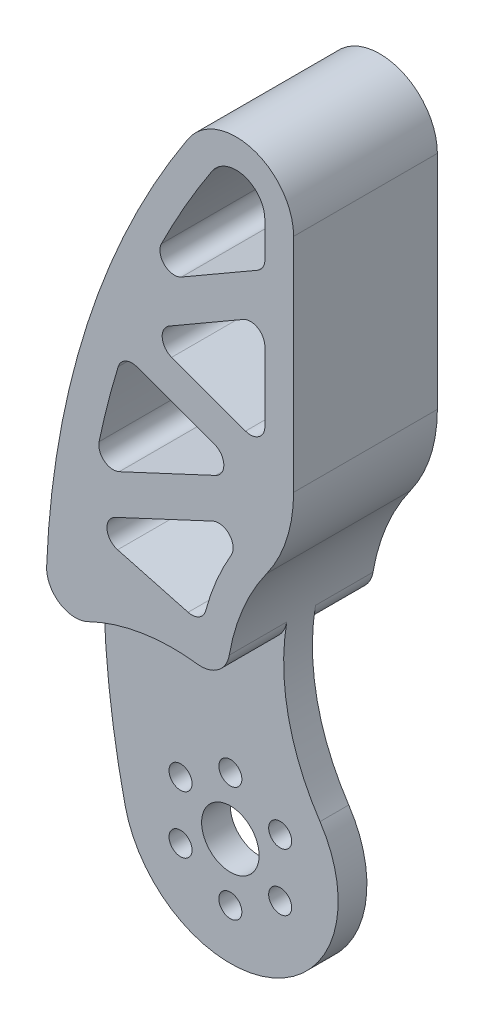
from build123d import *
from build123d.topology import SkipClean

# Parameters (mm, degrees)
SKETCH_1_R           = 15
SKETCH_1_R_2         = 4
SKETCH_1_R_3         = 1.6
EXTRUDE_1_DEPTH      = 4
EXTRUDE_START        = -4
EXTRUDE_3_DEPTH      = 4
EXTRUDE_4_DEPTH      = 8
EXTRUDE_4_DEPTH_BACK = 12
CUT_EXTRUDE_1_DEPTH  = 46


with BuildPart() as part:
    # 草图1 → 凸台-拉伸1 (new body)
    with BuildSketch(Plane.XY):
        Circle(SKETCH_1_R)
        Circle(SKETCH_1_R_2, mode=Mode.SUBTRACT)
        with Locations((0, 8)):
            Circle(SKETCH_1_R_3, mode=Mode.SUBTRACT)
        with Locations((6.92820323, 4)):
            Circle(SKETCH_1_R_3, mode=Mode.SUBTRACT)
        with Locations((6.92820323, -4)):
            Circle(SKETCH_1_R_3, mode=Mode.SUBTRACT)
        with Locations((0, -8)):
            Circle(SKETCH_1_R_3, mode=Mode.SUBTRACT)
        with Locations((-6.92820323, -4)):
            Circle(SKETCH_1_R_3, mode=Mode.SUBTRACT)
        with Locations((-6.92820323, 4)):
            Circle(SKETCH_1_R_3, mode=Mode.SUBTRACT)
    extrude(amount=EXTRUDE_1_DEPTH)

    # 草图2 → 凸台-拉伸3 (add)
    with BuildSketch(Plane.XY.offset(4).offset(EXTRUDE_START)):
        with BuildLine():
            Line((16.8, 85), (16.8, 54.159799849))
            ThreePointArc((16.8, 54.159799849), (15.83854762, 48.033324147), (13.046629547, 42.49587991))
            ThreePointArc((13.046629547, 42.49587991), (7.420814059, 25.504374344), (12.472191289, 8.333333333))
            ThreePointArc((12.472191289, 8.333333333), (-5.937882388, 13.774670695), (-14.621995932, -3.346226976))
            ThreePointArc((-14.621995932, -3.346226976), (-15.737901413, 44.738127218), (2.117573463, 89.398315084))
            ThreePointArc((2.117573463, 89.398315084), (11.095712057, 92.663530919), (16.8, 85))
        make_face()
    extrude(amount=EXTRUDE_3_DEPTH)

    # 草图3 → 凸台-拉伸4 (add, two sides: drawn at the far end of the back side and taken through both)
    with SkipClean():  # the faces are left unmerged after this step: merging them gives an invalid solid
        with BuildSketch(Plane.XY.offset(4).offset(-EXTRUDE_4_DEPTH_BACK)):
            with BuildLine():
                Line((16.8, 54.159799849), (16.8, 85))
                ThreePointArc((16.8, 85), (11.095712057, 92.663530919), (2.117573463, 89.398315084))
                ThreePointArc((2.117573463, 89.398315084), (-11.916705707, 60.059804871), (-17.55757213, 28.030290369))
                ThreePointArc((-17.55757213, 28.030290369), (-15.746673, 24.526996644), (-11.810776072, 24.27973576))
                ThreePointArc((-11.810776072, 24.27973576), (-4.386649325, 26.64127076), (3.402697603, 26.784727906))
                ThreePointArc((3.402697603, 26.784727906), (6.286614818, 27.53779516), (7.849127177, 30.076031539))
                ThreePointArc((7.849127177, 30.076031539), (9.742150736, 36.581291134), (13.046629547, 42.49587991))
                ThreePointArc((13.046629547, 42.49587991), (15.83854762, 48.033324147), (16.8, 54.159799849))
            make_face()
        extrude(amount=EXTRUDE_4_DEPTH + EXTRUDE_4_DEPTH_BACK)
    add(part.part.scale(1), mode=Mode.REPLACE)  # the faces are merged on a copy

    # 草图5 → 切除-拉伸1 (cut)
    with BuildSketch(Plane(origin=(0, 0, -8), x_dir=(-1, 0, 0), z_dir=(0, 0, -1))):
        with BuildLine():
            Line((-12.8, 69.762395693), (-12.8, 60.082793322))
            ThreePointArc((-12.8, 60.082793322), (-11.947152873, 58.444489233), (-10.115959713, 58.20340808))
            Line((-10.115959713, 58.20340808), (0.167044148, 61.946115404))
            ThreePointArc((0.167044148, 61.946115404), (1.475393257, 63.65118916), (0.483003861, 65.557551453))
            Line((0.483003861, 65.557551453), (-9.8, 71.494446501))
            ThreePointArc((-9.8, 71.494446501), (-11.8, 71.494446501), (-12.8, 69.762395693))
        make_face()
        with BuildLine():
            Line((-11.8, 78.422649731), (-1.206357847, 72.306407582))
            ThreePointArc((-1.206357847, 72.306407582), (1.162211364, 72.580028303), (1.585705551, 74.926438557))
            ThreePointArc((1.585705551, 74.926438557), (-1.749223409, 81.170317372), (-5.458786731, 87.199157542))
            ThreePointArc((-5.458786731, 87.199157542), (-9.947856029, 88.83176546), (-12.8, 85))
            Line((-12.8, 85), (-12.8, 80.154700538))
            ThreePointArc((-12.8, 80.154700538), (-12.532050808, 79.154700538), (-11.8, 78.422649731))
        make_face()
        with BuildLine():
            Line((5.01005666, 58.38793894), (-5.776995128, 54.461773174))
            ThreePointArc((-5.776995128, 54.461773174), (-7.091051284, 52.669626708), (-5.938191364, 50.769772359))
            Line((-5.938191364, 50.769772359), (7.453099332, 44.525310955))
            ThreePointArc((7.453099332, 44.525310955), (9.539258698, 44.76945259), (10.256783773, 46.743490028))
            ThreePointArc((10.256783773, 46.743490028), (9.051891671, 51.949605837), (7.60645214, 57.094128298))
            ThreePointArc((7.60645214, 57.094128298), (6.586103601, 58.298616303), (5.01005666, 58.38793894))
        make_face()
        with BuildLine():
            Line((-2.123332063, 32.377143259), (7.681973135, 35.004466868))
            ThreePointArc((7.681973135, 35.004466868), (9.156724441, 36.762007035), (8.009571568, 38.748934095))
            Line((8.009571568, 38.748934095), (-5.543860738, 45.069003373))
            ThreePointArc((-5.543860738, 45.069003373), (-7.869208523, 44.601479118), (-8.112845962, 42.242144033))
            ThreePointArc((-8.112845962, 42.242144033), (-6.056960525, 38.136767143), (-4.572948137, 33.791828527))
            ThreePointArc((-4.572948137, 33.791828527), (-3.641181599, 32.577066199), (-2.123332063, 32.377143259))
        make_face()
    extrude(amount=-CUT_EXTRUDE_1_DEPTH, mode=Mode.SUBTRACT)


solid = part.part
